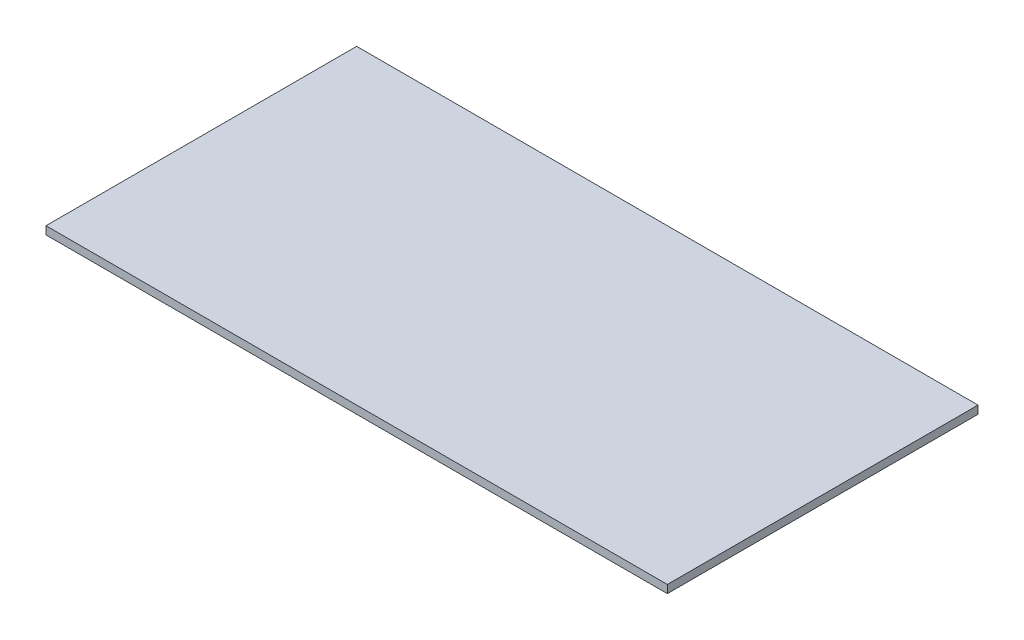
from build123d import *

# Parameters (mm, degrees)
SKETCH1_W           = 1400
SKETCH1_H           = 700
BOSS_EXTRUDE1_DEPTH = 18


with BuildPart() as part:
    # Sketch1 → Boss-Extrude1 (new body)
    with BuildSketch(Plane(origin=(0, 0, 0), x_dir=(1, 0, 0), z_dir=(0, 1, 0))):
        Rectangle(SKETCH1_W, SKETCH1_H)
    extrude(amount=BOSS_EXTRUDE1_DEPTH)


solid = part.part
